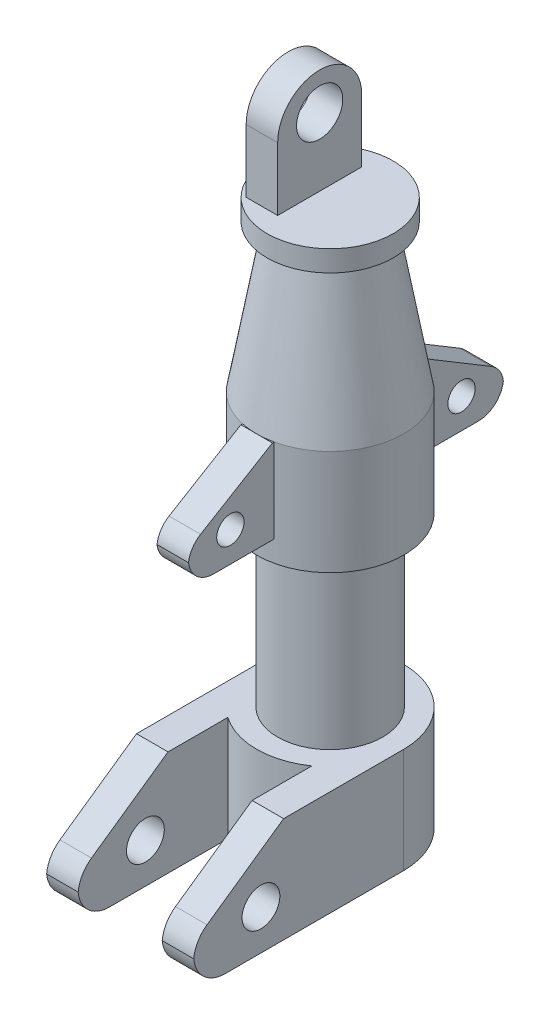
from build123d import *

# Parameters (mm, degrees)
SKETCH1_R           = 35
BOSS_EXTRUDE1_DEPTH = 50
SKETCH6_R           = 25
BOSS_EXTRUDE2_DEPTH = 80
SKETCH7_R           = 35
BOSS_EXTRUDE3_DEPTH = 50
SKETCH10_R          = 30
BOSS_EXTRUDE5_DEPTH = 10
SKETCH12_W          = 70
SKETCH12_H          = 100.009163948
BOSS_EXTRUDE6_DEPTH = 50
CUT_EXTRUDE1_DEPTH  = 288.231322933
CUT_EXTRUDE2_DEPTH  = 281.761166962
FILLET1_R           = 15
SKETCH15_R          = 9
CUT_EXTRUDE3_DEPTH  = 288.208392811
BOSS_EXTRUDE8_DEPTH = 7.5
FILLET2_R           = 12
SKETCH17_R          = 6.5
CUT_EXTRUDE4_DEPTH  = 282.771025659
FILLET3_R           = 12
SKETCH18_W          = 15
SKETCH18_H          = 40
BOSS_EXTRUDE9_DEPTH = 50
CUT_EXTRUDE5_DEPTH  = 331.323570005
SKETCH20_R          = 11
CUT_EXTRUDE6_DEPTH  = 331.323570005
SKETCH21_R          = 20
CUT_EXTRUDE7_DEPTH  = 235


with BuildPart() as part:
    # Sketch1 → Boss-Extrude1 (new body)
    with BuildSketch(Plane(origin=(0, 0, 0), x_dir=(1, 0, 0), z_dir=(0, 1, 0))):
        with Locations(Location((0, 0, 0), (0, 0, 270))):
            Circle(SKETCH1_R)
    extrude(amount=BOSS_EXTRUDE1_DEPTH)

    # Sketch6 → Boss-Extrude2 (add)
    with BuildSketch(Plane(origin=(0, 50, 0), x_dir=(1, 0, 0), z_dir=(0, 1, 0))):
        with Locations(Location((0, 0, 0), (0, 0, 270))):
            Circle(SKETCH6_R)
    extrude(amount=BOSS_EXTRUDE2_DEPTH)

    # Sketch7 → Boss-Extrude3 (add)
    with BuildSketch(Plane(origin=(0, 130, 0), x_dir=(1, 0, 0), z_dir=(0, 1, 0))):
        with Locations(Location((0, 0, 0), (0, 0, 270))):
            Circle(SKETCH7_R)
    extrude(amount=BOSS_EXTRUDE3_DEPTH)



with BuildPart() as body_2:
    # Sketch10 → Boss-Extrude5 (new body)
    with BuildSketch(Plane(origin=(0, 250, 0), x_dir=(1, 0, 0), z_dir=(0, 1, 0))):
        with Locations(Location((0, 0, 0), (0, 0, 270))):
            Circle(SKETCH10_R)
    extrude(amount=BOSS_EXTRUDE5_DEPTH)


with BuildPart() as part_1:
    add(part.part)

    add(body_2.part)  # Revolve1 merges body 2
    # Sketch11 → Revolve1 (revolve)
    with BuildSketch(Plane(origin=(0, 0, 0), x_dir=(0, 0, -1), z_dir=(1, 0, 0))):
        Polygon((0, 250), (22.65711135, 250), (35, 180), (0, 180), align=None)
    revolve(axis=Axis((0, 180, 0), (0, 1, 0)))

    # Sketch12 → Boss-Extrude6 (add)
    with BuildSketch(Plane.XZ):
        with Locations((0, 50.004581974)):
            Rectangle(SKETCH12_W, SKETCH12_H)
    extrude(amount=-BOSS_EXTRUDE6_DEPTH)

    # Sketch13 → Cut-Extrude1 (cut, through all)
    with BuildSketch(Plane.ZY.offset(35)):
        Polygon((57.164723746, 50), (100.009163948, 20), (100.009163948, 50), align=None)
    extrude(amount=-CUT_EXTRUDE1_DEPTH, mode=Mode.SUBTRACT)

    # Sketch14 → Cut-Extrude2 (cut, through all)
    with BuildSketch(Plane.XZ):
        with BuildLine():
            Line((-20, 108.740570097), (20, 108.740570097))
            Line((20, 108.740570097), (20, 28.722813233))
            ThreePointArc((20, 28.722813233), (0, 35), (-20, 28.722813233))
            Line((-20, 28.722813233), (-20, 108.740570097))
        make_face()
    extrude(amount=-CUT_EXTRUDE2_DEPTH, mode=Mode.SUBTRACT)

    # Fillet1
    # the kernel refuses this fillet: 15 mm, written as the material it takes off along each edge
    with BuildSketch(Plane(origin=(-17.5, 0, 100.009163948), x_dir=(0, 0, -1), z_dir=(1, 0, 0)), Plane(origin=(-72.5, 0, 100.009163948), x_dir=(0, 0, -1), z_dir=(1, 0, 0))) as fillet1_piece_1:
        with BuildLine():
            CenterArc((FILLET1_R, FILLET1_R), FILLET1_R, 180, 90)
            Line((0, FILLET1_R), (0, 0))
            Line((0, 0), (FILLET1_R, 0))
        make_face()
    extrude(amount=90, mode=Mode.SUBTRACT)
    with BuildSketch(Plane(origin=(0.478735604, 20, 100.009163948), x_dir=(0, -1, 0), z_dir=(1, 0, 0)), Plane(origin=(-54.521264396, 20, 100.009163948), x_dir=(0, -1, 0), z_dir=(1, 0, 0))) as fillet1_piece_2:
        with BuildLine():
            CenterArc((FILLET1_R * 0.520567050552, FILLET1_R), FILLET1_R, 215, 55)
            Line((-FILLET1_R * 0.298584993737, FILLET1_R * 0.426423563649), (0, 0))
            Line((0, 0), (FILLET1_R * 0.520567050552, 0))
        make_face()
    extrude(amount=54.042528791, mode=Mode.SUBTRACT)

    # Sketch15 → Cut-Extrude3 (cut, through all)
    with BuildSketch(Plane.ZY.offset(35)):
        with Locations((67.943288424, 19)):
            Circle(SKETCH15_R)
    extrude(amount=-CUT_EXTRUDE3_DEPTH, mode=Mode.SUBTRACT)

    # Sketch16 → Boss-Extrude8 (add, symmetric)
    with BuildSketch(Plane(origin=(0, 0, 0), x_dir=(0, 0, -1), z_dir=(1, 0, 0))):
        Polygon((-35, 180), (-75, 155.965575239), (-75, 140), (-35, 140), (0, 140), (0, 180), align=None)
    boss_extrude8 = extrude(amount=BOSS_EXTRUDE8_DEPTH, both=True)

    # Fillet2
    # the kernel refuses this fillet: 12 mm, written as the material it takes off along each edge
    with BuildSketch(Plane(origin=(-37.5, 140, 75), x_dir=(0, 0, -1), z_dir=(1, 0, 0))) as fillet2_piece_1:
        with BuildLine():
            CenterArc((FILLET2_R, FILLET2_R), FILLET2_R, 180, 90)
            Line((0, FILLET2_R), (0, 0))
            Line((0, 0), (FILLET2_R, 0))
        make_face()
    extrude(amount=75, mode=Mode.SUBTRACT)
    with BuildSketch(Plane(origin=(-24.473183346, 155.965575239, 75), x_dir=(0, 0.5150380749100483, -0.8571673007021159), z_dir=(1, 0, 0))) as fillet2_piece_2:
        with BuildLine():
            CenterArc((FILLET2_R * 0.565772778188, -FILLET2_R), FILLET2_R, 90, 59)
            Line((-FILLET2_R * 0.291394522514, -FILLET2_R * 0.48496192509), (0, 0))
            Line((0, 0), (FILLET2_R * 0.565772778188, 0))
        make_face()
    extrude(amount=48.946366691, mode=Mode.SUBTRACT)

    # Sketch17 → Cut-Extrude4 (cut, through all)
    with BuildSketch(Plane(origin=(7.5, 0, 0), x_dir=(0, 0, -1), z_dir=(1, 0, 0))):
        with Locations((-55, 154.29)):
            Circle(SKETCH17_R)
    cut_extrude4 = extrude(amount=-CUT_EXTRUDE4_DEPTH, mode=Mode.SUBTRACT)

    # Mirror1: Boss-Extrude8 across plane
    add(boss_extrude8.mirror(Plane.XY))

    # Fillet3
    # the kernel refuses this fillet: 12 mm, written as the material it takes off along each edge
    with BuildSketch(Plane(origin=(-37.5, 140, -75), x_dir=(0, 0, 1), z_dir=(1, 0, 0))) as fillet3_piece_1:
        with BuildLine():
            CenterArc((FILLET3_R, -FILLET3_R), FILLET3_R, 90, 90)
            Line((0, -FILLET3_R), (0, 0))
            Line((0, 0), (FILLET3_R, 0))
        make_face()
    extrude(amount=75, mode=Mode.SUBTRACT)
    with BuildSketch(Plane(origin=(-24.473183346, 155.965575239, -75), x_dir=(0, 0.5150380749100483, 0.8571673007021159), z_dir=(1, 0, 0))) as fillet3_piece_2:
        with BuildLine():
            CenterArc((FILLET3_R * 0.565772778188, FILLET3_R), FILLET3_R, 211, 59)
            Line((-FILLET3_R * 0.291394522514, FILLET3_R * 0.48496192509), (0, 0))
            Line((0, 0), (FILLET3_R * 0.565772778188, 0))
        make_face()
    extrude(amount=48.946366691, mode=Mode.SUBTRACT)

    # Mirror2: Cut-Extrude4 across plane
    add(cut_extrude4.mirror(Plane.XY), mode=Mode.SUBTRACT)

    # Sketch18 → Boss-Extrude9 (add)
    with BuildSketch(Plane(origin=(0, 260, 0), x_dir=(1, 0, 0), z_dir=(0, 1, 0))):
        with Locations((-12.5, 0)):
            Rectangle(SKETCH18_W, SKETCH18_H)
    extrude(amount=BOSS_EXTRUDE9_DEPTH)

    # Sketch19 → Cut-Extrude5 (cut, through all)
    with BuildSketch(Plane.ZY.offset(20)):
        with BuildLine():
            Line((20, 310), (-1.45e-07, 310))
            ThreePointArc((-1.45e-07, 310), (14.142135572, 304.142135675), (20, 290))
            Line((20, 290), (20, 310))
        make_face()
        with BuildLine():
            Line((-20, 310), (-20, 290))
            ThreePointArc((-20, 290), (-14.142135675, 304.142135572), (-1.45e-07, 310))
            Line((-1.45e-07, 310), (-20, 310))
        make_face()
    extrude(amount=-CUT_EXTRUDE5_DEPTH, mode=Mode.SUBTRACT)

    # Sketch20 → Cut-Extrude6 (cut, through all)
    with BuildSketch(Plane.ZY.offset(20)):
        with Locations((0, 292.448780647)):
            Circle(SKETCH20_R)
    extrude(amount=-CUT_EXTRUDE6_DEPTH, mode=Mode.SUBTRACT)

    # Sketch21 → Cut-Extrude7 (cut)
    with BuildSketch(Plane.XZ):
        with Locations(Location((0, 0, 0), (0, 0, 270))):
            Circle(SKETCH21_R)
    extrude(amount=-CUT_EXTRUDE7_DEPTH, mode=Mode.SUBTRACT)


solid = part_1.part
